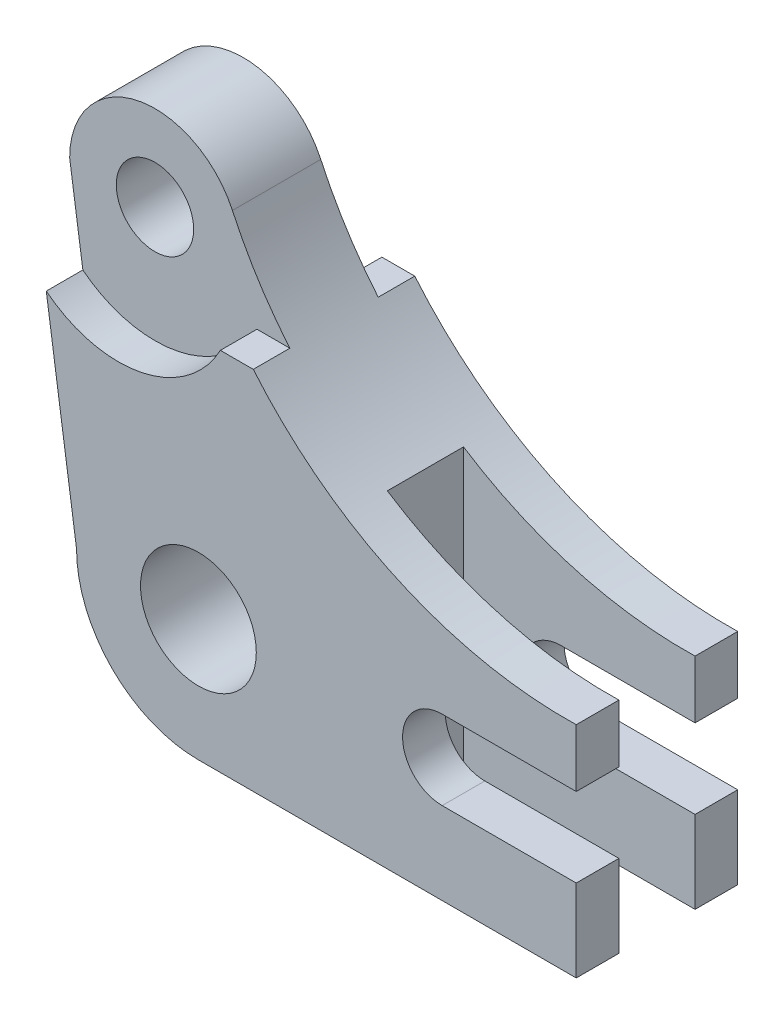
from build123d import *

# Parameters (mm, degrees)
SKETCH1_R               = 6.35
SKETCH1_R_2             = 9.5
BOSS_EXTRUDE2_DEPTH     = 13.25
CUT_EXTRUDE2_START      = -7
SKETCH2_W               = 38
SKETCH2_H               = 74
CUT_EXTRUDE2_DEPTH      = 12.5
CUT_EXTRUDE3_DEPTH      = 93.278112248
CUT_EXTRUDE3_DEPTH_BACK = 6
CUT_EXTRUDE4_DEPTH      = 93.278112248
CUT_EXTRUDE4_DEPTH_BACK = 6
SKETCH4_R               = 6.35


with BuildPart() as part:
    # Sketch1 → Boss-Extrude2 (new, symmetric)
    with BuildSketch(Plane.XY):
        with BuildLine():
            ThreePointArc((-0.421043253, 54.873232673), (-16.136291061, 62.673305022), (-27.129510429, 49))
            Line((-27.129510429, 49), (-20, 0))
            ThreePointArc((-20, 0), (-14.142135624, -14.142135624), (0, -20))
            Line((0, -20), (62, -20))
            Line((62, -20), (62, -6.5))
            Line((62, -6.5), (40, -6.5))
            ThreePointArc((40, -6.5), (33.5, 0), (40, 6.5))
            Line((40, 6.5), (62, 6.5))
            Line((62, 6.5), (62, 16))
            ThreePointArc((62, 16), (24.979840385, 26.107737846), (-0.421043253, 54.873232673))
        make_face()
        with Locations((-13.129510429, 49)):
            Circle(SKETCH1_R, mode=Mode.SUBTRACT)
        Circle(SKETCH1_R_2, mode=Mode.SUBTRACT)
    extrude(amount=BOSS_EXTRUDE2_DEPTH, both=True)

    # Sketch2 → Cut-Extrude2 (cut)
    with BuildSketch(Plane.XY.offset(13.25).offset(CUT_EXTRUDE2_START)):
        with Locations((43, 17)):
            Rectangle(SKETCH2_W, SKETCH2_H)
    extrude(amount=-CUT_EXTRUDE2_DEPTH, mode=Mode.SUBTRACT)

    # Sketch3 → Cut-Extrude3 (cut, two sides: drawn at the far end of the back side and taken through both)
    with BuildSketch(Plane.XY.offset(13.25).offset(-CUT_EXTRUDE3_DEPTH_BACK)):
        with BuildLine():
            Line((-192.463990678, 169.331455297), (-25.062987406, 34.215138579))
            ThreePointArc((-25.062987406, 34.215138579), (-9.371120885, 30.375432675), (3.603690102, 40))
            Line((3.603690102, 40), (9.001095845, 40))
            Line((9.001095845, 40), (224.127837419, 40))
            Line((224.127837419, 40), (351.694520769, 450.907290102))
            Line((351.694520769, 450.907290102), (-64.897307328, 580.238745399))
            Line((-64.897307328, 580.238745399), (-192.463990678, 169.331455297))
        make_face()
    extrude(amount=CUT_EXTRUDE3_DEPTH + CUT_EXTRUDE3_DEPTH_BACK, mode=Mode.SUBTRACT)

    # Sketch4 → Cut-Extrude4 (cut, two sides: drawn at the far end of the back side and taken through both)
    with BuildSketch(Plane(origin=(0, 0, -13.25), x_dir=(-1, 0, 0), z_dir=(0, 0, -1)).offset(-CUT_EXTRUDE4_DEPTH_BACK)):
        with BuildLine():
            Line((-9.001095845, 40), (-3.603690102, 40))
            ThreePointArc((-3.603690102, 40), (9.310919071, 30.387682572), (24.967126384, 34.138275722))
            Line((24.967126384, 34.138275722), (27.129510429, 49))
            ThreePointArc((27.129510429, 49), (16.136291061, 62.673305022), (0.421043253, 54.873232673))
            ThreePointArc((0.421043253, 54.873232673), (-3.799343417, 47.125770508), (-9.001095845, 40))
        make_face()
        with Locations((13.129510429, 49)):
            Circle(SKETCH4_R, mode=Mode.SUBTRACT)
    extrude(amount=CUT_EXTRUDE4_DEPTH + CUT_EXTRUDE4_DEPTH_BACK, mode=Mode.SUBTRACT)


solid = part.part
